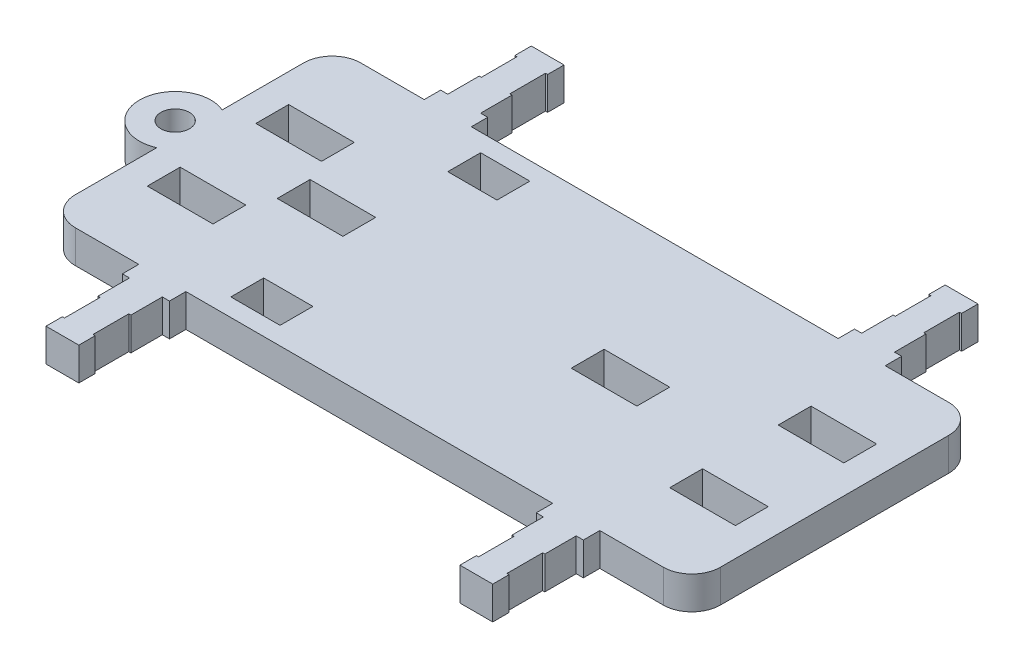
from build123d import *

# Parameters (mm, degrees)
BASE_FLANGE1_DEPTH = 2.3
CUT_EXTRUDE2_REACH = 26.82
SKETCH12_W         = 4.6
SKETCH12_H         = 2.3
SKETCH12_W_2       = 3.45
SKETCH6_W          = 3.3
SKETCH6_H          = 7
TAB1_DEPTH         = 2.3
CUT_EXTRUDE1_REACH = 30.373
SKETCH10_R         = 2.5
SKETCH10_R_2       = 1
TAB2_DEPTH         = 2.3


# Sheet-metal steps are written as plain solids
with BuildPart() as part:
    # Sketch1 → Base-Flange1 (new body)
    with BuildSketch(Plane(origin=(0, 0, 0), x_dir=(1, 0, 0), z_dir=(0, 1, 0))):
        with BuildLine():
            Line((-20.6, -10), (20.6, -10))
            ThreePointArc((20.6, -10), (22.014213562, -9.414213562), (22.6, -8))
            Line((22.6, -8), (22.6, 8))
            ThreePointArc((22.6, 8), (22.014213562, 9.414213562), (20.6, 10))
            Line((20.6, 10), (-20.6, 10))
            ThreePointArc((-20.6, 10), (-22.014213562, 9.414213562), (-22.6, 8))
            Line((-22.6, 8), (-22.6, -8))
            ThreePointArc((-22.6, -8), (-22.014213562, -9.414213562), (-20.6, -10))
        make_face()
    extrude(amount=-BASE_FLANGE1_DEPTH)

    # Sketch12 → Cut-Extrude2 (cut, up to next)
    with BuildSketch(Plane(origin=(0, 0, 0), x_dir=(1, 0, 0), z_dir=(0, 1, 0)), mode=Mode.PRIVATE) as cut_extrude2_sk1:
        with Locations((-13, 0)):
            Rectangle(SKETCH12_W, SKETCH12_H)
    cut_extrude2_tool1 = extrude(cut_extrude2_sk1.sketch, amount=-CUT_EXTRUDE2_REACH, mode=Mode.PRIVATE) & part.part
    # Sketch12 → Cut-Extrude2 (cut, up to next)
    with BuildSketch(Plane(origin=(0, 0, 0), x_dir=(1, 0, 0), z_dir=(0, 1, 0)), mode=Mode.PRIVATE) as cut_extrude2_sk2:
        with Locations((7.6, 0)):
            Rectangle(SKETCH12_W, SKETCH12_H)
    cut_extrude2_tool2 = extrude(cut_extrude2_sk2.sketch, amount=-CUT_EXTRUDE2_REACH, mode=Mode.PRIVATE) & part.part
    # Sketch12 → Cut-Extrude2 (cut, up to next)
    with BuildSketch(Plane(origin=(0, 0, 0), x_dir=(1, 0, 0), z_dir=(0, 1, 0)), mode=Mode.PRIVATE) as cut_extrude2_sk3:
        with Locations((-18.3, 3.8)):
            Rectangle(SKETCH12_W, SKETCH12_H)
    cut_extrude2_tool3 = extrude(cut_extrude2_sk3.sketch, amount=-CUT_EXTRUDE2_REACH, mode=Mode.PRIVATE) & part.part
    # Sketch12 → Cut-Extrude2 (cut, up to next)
    with BuildSketch(Plane(origin=(0, 0, 0), x_dir=(1, 0, 0), z_dir=(0, 1, 0)), mode=Mode.PRIVATE) as cut_extrude2_sk4:
        with Locations((18.3, 3.8)):
            Rectangle(SKETCH12_W, SKETCH12_H)
    cut_extrude2_tool4 = extrude(cut_extrude2_sk4.sketch, amount=-CUT_EXTRUDE2_REACH, mode=Mode.PRIVATE) & part.part
    # Sketch12 → Cut-Extrude2 (cut, up to next)
    with BuildSketch(Plane(origin=(0, 0, 0), x_dir=(1, 0, 0), z_dir=(0, 1, 0)), mode=Mode.PRIVATE) as cut_extrude2_sk5:
        with Locations((-18.3, -3.8)):
            Rectangle(SKETCH12_W, SKETCH12_H)
    cut_extrude2_tool5 = extrude(cut_extrude2_sk5.sketch, amount=-CUT_EXTRUDE2_REACH, mode=Mode.PRIVATE) & part.part
    # Sketch12 → Cut-Extrude2 (cut, up to next)
    with BuildSketch(Plane(origin=(0, 0, 0), x_dir=(1, 0, 0), z_dir=(0, 1, 0)), mode=Mode.PRIVATE) as cut_extrude2_sk6:
        with Locations((18.3, -3.8)):
            Rectangle(SKETCH12_W, SKETCH12_H)
    cut_extrude2_tool6 = extrude(cut_extrude2_sk6.sketch, amount=-CUT_EXTRUDE2_REACH, mode=Mode.PRIVATE) & part.part
    # Sketch12 → Cut-Extrude2 (cut, up to next)
    with BuildSketch(Plane(origin=(0, 0, 0), x_dir=(1, 0, 0), z_dir=(0, 1, 0)), mode=Mode.PRIVATE) as cut_extrude2_sk7:
        with Locations((-9.225, 7.6)):
            Rectangle(SKETCH12_W_2, SKETCH12_H)
    cut_extrude2_tool7 = extrude(cut_extrude2_sk7.sketch, amount=-CUT_EXTRUDE2_REACH, mode=Mode.PRIVATE) & part.part
    # Sketch12 → Cut-Extrude2 (cut, up to next)
    with BuildSketch(Plane(origin=(0, 0, 0), x_dir=(1, 0, 0), z_dir=(0, 1, 0)), mode=Mode.PRIVATE) as cut_extrude2_sk8:
        with Locations((-9.225, -7.6)):
            Rectangle(SKETCH12_W_2, SKETCH12_H)
    cut_extrude2_tool8 = extrude(cut_extrude2_sk8.sketch, amount=-CUT_EXTRUDE2_REACH, mode=Mode.PRIVATE) & part.part
    add(cut_extrude2_tool1.solids().sort_by_distance((-13, 0, 0))[0], mode=Mode.SUBTRACT)
    add(cut_extrude2_tool2.solids().sort_by_distance((7.6, 0, 0))[0], mode=Mode.SUBTRACT)
    add(cut_extrude2_tool3.solids().sort_by_distance((-18.3, 0, -3.8))[0], mode=Mode.SUBTRACT)
    add(cut_extrude2_tool4.solids().sort_by_distance((18.3, 0, -3.8))[0], mode=Mode.SUBTRACT)
    add(cut_extrude2_tool5.solids().sort_by_distance((-18.3, 0, 3.8))[0], mode=Mode.SUBTRACT)
    add(cut_extrude2_tool6.solids().sort_by_distance((18.3, 0, 3.8))[0], mode=Mode.SUBTRACT)
    add(cut_extrude2_tool7.solids().sort_by_distance((-9.225, 0, -7.6))[0], mode=Mode.SUBTRACT)
    add(cut_extrude2_tool8.solids().sort_by_distance((-9.225, 0, 7.6))[0], mode=Mode.SUBTRACT)

    # Sketch6 → Tab1 (add)
    with BuildSketch(Plane(origin=(0, 0, 0), x_dir=(1, 0, 0), z_dir=(0, 1, 0))):
        with Locations((-14.5, 13.5)):
            Rectangle(SKETCH6_W, SKETCH6_H)
        with Locations((14.5, 13.5)):
            Rectangle(SKETCH6_W, SKETCH6_H)
        with Locations((14.5, -13.5)):
            Rectangle(SKETCH6_W, SKETCH6_H)
        with Locations((-14.5, -13.5)):
            Rectangle(SKETCH6_W, SKETCH6_H)
    extrude(amount=-TAB1_DEPTH)

    # Sketch9 → Cut-Extrude1 (cut, up to next)
    with BuildSketch(Plane(origin=(0, 0, 0), x_dir=(1, 0, 0), z_dir=(0, 1, 0)), mode=Mode.PRIVATE) as cut_extrude1_sk1:
        Polygon((-12.85, 11.15), (-13.35, 11.15), (-13.35, 13.35), (-13.5, 13.35), (-13.5, 15.85), (-13.35, 15.85), (-13.35, 17), (-12.85, 17), align=None)
    cut_extrude1_tool1 = extrude(cut_extrude1_sk1.sketch, amount=-CUT_EXTRUDE1_REACH, mode=Mode.PRIVATE) & part.part
    # Sketch9 → Cut-Extrude1 (cut, up to next)
    with BuildSketch(Plane(origin=(0, 0, 0), x_dir=(1, 0, 0), z_dir=(0, 1, 0)), mode=Mode.PRIVATE) as cut_extrude1_sk2:
        Polygon((-16.15, 17), (-16.15, 11.15), (-15.65, 11.15), (-15.65, 13.35), (-15.5, 13.35), (-15.5, 15.85), (-15.65, 15.85), (-15.65, 17), align=None)
    cut_extrude1_tool2 = extrude(cut_extrude1_sk2.sketch, amount=-CUT_EXTRUDE1_REACH, mode=Mode.PRIVATE) & part.part
    # Sketch9 → Cut-Extrude1 (cut, up to next)
    with BuildSketch(Plane(origin=(0, 0, 0), x_dir=(1, 0, 0), z_dir=(0, 1, 0)), mode=Mode.PRIVATE) as cut_extrude1_sk3:
        Polygon((-16.15, -11.15), (-15.65, -11.15), (-15.65, -13.35), (-15.5, -13.35), (-15.5, -15.85), (-15.65, -15.85), (-15.65, -17), (-16.15, -17), align=None)
    cut_extrude1_tool3 = extrude(cut_extrude1_sk3.sketch, amount=-CUT_EXTRUDE1_REACH, mode=Mode.PRIVATE) & part.part
    # Sketch9 → Cut-Extrude1 (cut, up to next)
    with BuildSketch(Plane(origin=(0, 0, 0), x_dir=(1, 0, 0), z_dir=(0, 1, 0)), mode=Mode.PRIVATE) as cut_extrude1_sk4:
        Polygon((-12.85, -17), (-12.85, -11.15), (-13.35, -11.15), (-13.35, -13.35), (-13.5, -13.35), (-13.5, -15.85), (-13.35, -15.85), (-13.35, -17), align=None)
    cut_extrude1_tool4 = extrude(cut_extrude1_sk4.sketch, amount=-CUT_EXTRUDE1_REACH, mode=Mode.PRIVATE) & part.part
    # Sketch9 → Cut-Extrude1 (cut, up to next)
    with BuildSketch(Plane(origin=(0, 0, 0), x_dir=(1, 0, 0), z_dir=(0, 1, 0)), mode=Mode.PRIVATE) as cut_extrude1_sk5:
        Polygon((12.85, -11.15), (13.35, -11.15), (13.35, -13.35), (13.5, -13.35), (13.5, -15.85), (13.35, -15.85), (13.35, -17), (12.85, -17), align=None)
    cut_extrude1_tool5 = extrude(cut_extrude1_sk5.sketch, amount=-CUT_EXTRUDE1_REACH, mode=Mode.PRIVATE) & part.part
    # Sketch9 → Cut-Extrude1 (cut, up to next)
    with BuildSketch(Plane(origin=(0, 0, 0), x_dir=(1, 0, 0), z_dir=(0, 1, 0)), mode=Mode.PRIVATE) as cut_extrude1_sk6:
        Polygon((16.15, -17), (16.15, -11.15), (15.65, -11.15), (15.65, -13.35), (15.5, -13.35), (15.5, -15.85), (15.65, -15.85), (15.65, -17), align=None)
    cut_extrude1_tool6 = extrude(cut_extrude1_sk6.sketch, amount=-CUT_EXTRUDE1_REACH, mode=Mode.PRIVATE) & part.part
    # Sketch9 → Cut-Extrude1 (cut, up to next)
    with BuildSketch(Plane(origin=(0, 0, 0), x_dir=(1, 0, 0), z_dir=(0, 1, 0)), mode=Mode.PRIVATE) as cut_extrude1_sk7:
        Polygon((12.85, 17), (12.85, 11.15), (13.35, 11.15), (13.35, 13.35), (13.5, 13.35), (13.5, 15.85), (13.35, 15.85), (13.35, 17), align=None)
    cut_extrude1_tool7 = extrude(cut_extrude1_sk7.sketch, amount=-CUT_EXTRUDE1_REACH, mode=Mode.PRIVATE) & part.part
    # Sketch9 → Cut-Extrude1 (cut, up to next)
    with BuildSketch(Plane(origin=(0, 0, 0), x_dir=(1, 0, 0), z_dir=(0, 1, 0)), mode=Mode.PRIVATE) as cut_extrude1_sk8:
        Polygon((16.15, 11.15), (15.65, 11.15), (15.65, 13.35), (15.5, 13.35), (15.5, 15.85), (15.65, 15.85), (15.65, 17), (16.15, 17), align=None)
    cut_extrude1_tool8 = extrude(cut_extrude1_sk8.sketch, amount=-CUT_EXTRUDE1_REACH, mode=Mode.PRIVATE) & part.part
    add(cut_extrude1_tool1.solids().sort_by_distance((-13.136932, 0, -14.134659))[0], mode=Mode.SUBTRACT)
    add(cut_extrude1_tool2.solids().sort_by_distance((-15.863068, 0, -14.134659))[0], mode=Mode.SUBTRACT)
    add(cut_extrude1_tool3.solids().sort_by_distance((-15.863068, 0, 14.134659))[0], mode=Mode.SUBTRACT)
    add(cut_extrude1_tool4.solids().sort_by_distance((-13.136932, 0, 14.134659))[0], mode=Mode.SUBTRACT)
    add(cut_extrude1_tool5.solids().sort_by_distance((13.136932, 0, 14.134659))[0], mode=Mode.SUBTRACT)
    add(cut_extrude1_tool6.solids().sort_by_distance((15.863068, 0, 14.134659))[0], mode=Mode.SUBTRACT)
    add(cut_extrude1_tool7.solids().sort_by_distance((13.136932, 0, -14.134659))[0], mode=Mode.SUBTRACT)
    add(cut_extrude1_tool8.solids().sort_by_distance((15.863068, 0, -14.134659))[0], mode=Mode.SUBTRACT)

    # Sketch10 → Tab2 (add)
    with BuildSketch(Plane(origin=(0, 0, 0), x_dir=(1, 0, 0), z_dir=(0, 1, 0))):
        with Locations((-23.6, 0)):
            Circle(SKETCH10_R)
        with Locations(Location((-23.6, 0, 0), (0, 0, 270))):
            Circle(SKETCH10_R_2, mode=Mode.SUBTRACT)
    extrude(amount=-TAB2_DEPTH)


solid = part.part
